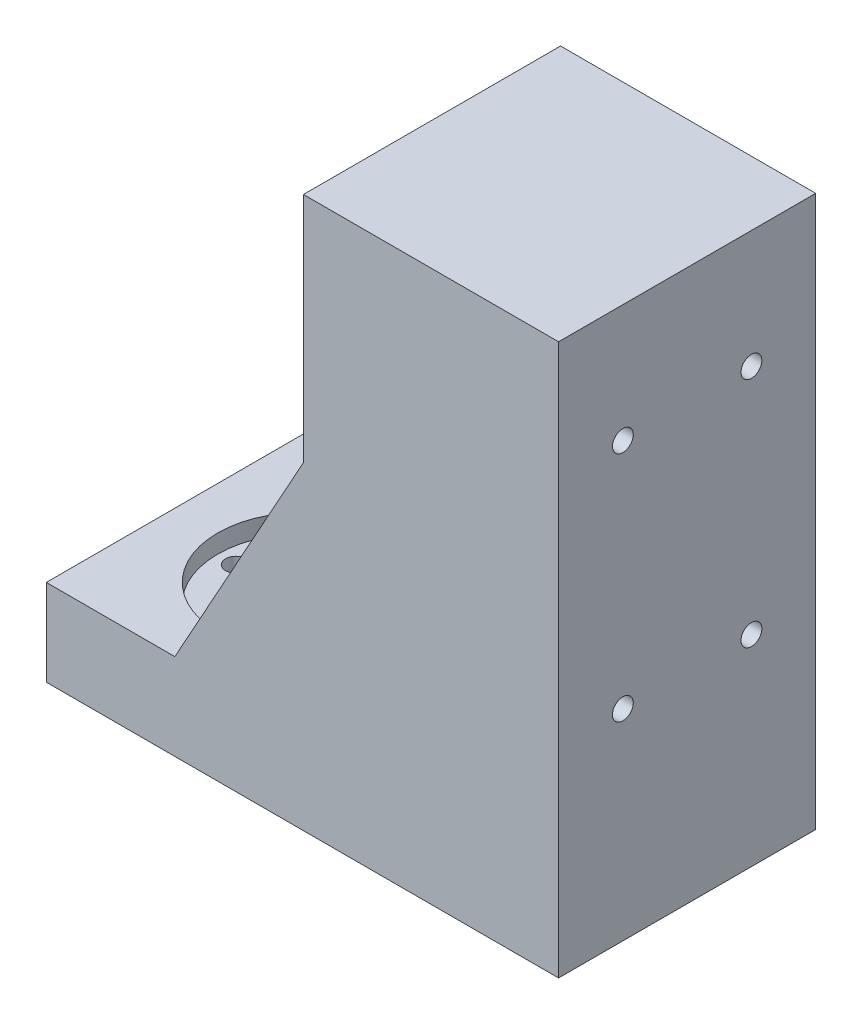
from build123d import *

# Parameters (mm, degrees)
BOSS_EXTRUDE1_DEPTH = 42
SKETCH3_R           = 3
CUT_EXTRUDE1_DEPTH  = 14.120795661
SKETCH4_R           = 14
CUT_EXTRUDE3_DEPTH  = 3
SKETCH5_R           = 9
CUT_EXTRUDE4_DEPTH  = 5
SKETCH6_R           = 1.7
CUT_EXTRUDE5_DEPTH  = 11.41
SKETCH7_R           = 1.7
CUT_EXTRUDE6_DEPTH  = 41.679003175
BOSS_EXTRUDE2_DEPTH = 2
BOSS_EXTRUDE3_DEPTH = 2


with BuildPart() as part:
    # Sketch1 → Boss-Extrude1 (new body)
    with BuildSketch(Plane.XY):
        Polygon((0, 0), (42, 0), (42, 75.879204339), (83.679003175, 75.879204339), (83.679003175, -14.120795661), (42, -14.120795661), (0, -14.120795661), align=None)
    extrude(amount=BOSS_EXTRUDE1_DEPTH)

    # Sketch3 → Cut-Extrude1 (cut)
    with BuildSketch(Plane(origin=(0, 0, 0), x_dir=(1, 0, 0), z_dir=(0, 1, 0))):
        with Locations((21, -21)):
            Circle(SKETCH3_R)
    extrude(amount=-CUT_EXTRUDE1_DEPTH, mode=Mode.SUBTRACT)

    # Sketch4 → Cut-Extrude3 (cut)
    with BuildSketch(Plane(origin=(0, 0, 0), x_dir=(1, 0, 0), z_dir=(0, 1, 0))):
        with Locations((21, -21)):
            Circle(SKETCH4_R)
    extrude(amount=-CUT_EXTRUDE3_DEPTH, mode=Mode.SUBTRACT)

    # Sketch5 → Cut-Extrude4 (cut)
    with BuildSketch(Plane(origin=(0, 0, 0), x_dir=(1, 0, 0), z_dir=(0, 1, 0))):
        with Locations((21, -21)):
            Circle(SKETCH5_R)
    extrude(amount=-CUT_EXTRUDE4_DEPTH, mode=Mode.SUBTRACT)

    # Sketch6 → Cut-Extrude5 (cut)
    with BuildSketch(Plane(origin=(0, -3, 0), x_dir=(1, 0, 0), z_dir=(0, 1, 0))):
        with Locations((21, -10)):
            Circle(SKETCH6_R)
        with Locations((32, -21)):
            Circle(SKETCH6_R)
        with Locations((21, -32)):
            Circle(SKETCH6_R)
        with Locations((10, -21)):
            Circle(SKETCH6_R)
    extrude(amount=-CUT_EXTRUDE5_DEPTH, mode=Mode.SUBTRACT)

    # Sketch7 → Cut-Extrude6 (cut)
    with BuildSketch(Plane.ZY.offset(-42)):
        with Locations((10.5, 56.654204339)):
            Circle(SKETCH7_R)
        with Locations((31.5, 56.654204339)):
            Circle(SKETCH7_R)
        with Locations((10.5, 18.71460217)):
            Circle(SKETCH7_R)
        with Locations((31.5, 18.71460217)):
            Circle(SKETCH7_R)
    extrude(amount=-CUT_EXTRUDE6_DEPTH, mode=Mode.SUBTRACT)

    # Sketch8 → Boss-Extrude2 (add)
    with BuildSketch(Plane.XY.offset(42)):
        Polygon((42, 37.93960217), (21, 0), (42, 0), align=None)
    extrude(amount=-BOSS_EXTRUDE2_DEPTH)

    # Sketch9 → Boss-Extrude3 (add)
    with BuildSketch(Plane(origin=(0, 0, 0), x_dir=(-1, 0, 0), z_dir=(0, 0, -1))):
        Polygon((-42, 37.93960217), (-21, 0), (-42, 0), align=None)
    extrude(amount=-BOSS_EXTRUDE3_DEPTH)


solid = part.part
